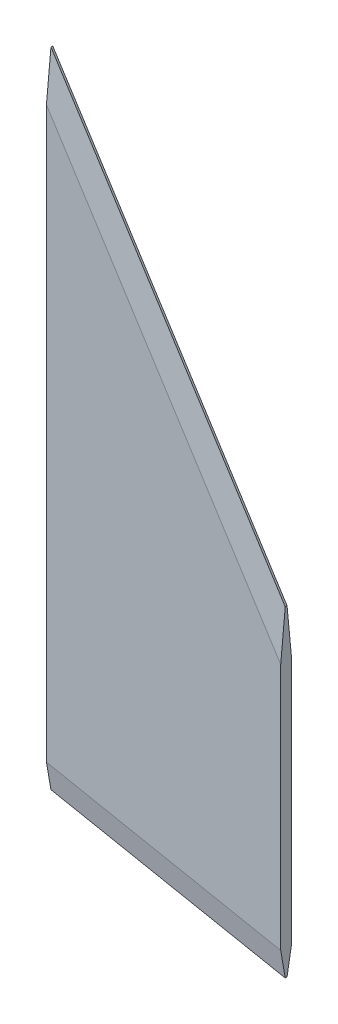
from build123d import *
from OCP.BRepFilletAPI import BRepFilletAPI_MakeChamfer

# Parameters (mm, degrees)
BOSS_EXTRUDE1_DEPTH = 1.5
CHAMFER1_SIZE       = 1.25
CHAMFER1_SIZE2      = 7.089102275


with BuildPart() as part:
    # Sketch1 → Boss-Extrude1 (new, symmetric)
    with BuildSketch(Plane.XY):
        Polygon((-60.98159975, 77.106512683), (-60.98159975, -100.693487317), (3.78840025, -113.393487317), (3.78840025, -24.493487317), align=None)
    extrude(amount=BOSS_EXTRUDE1_DEPTH, both=True)

    # Chamfer1: one chamfer whose edges measure the first distance from different faces: ONE call of the kernel's chamfer builder (chamfer() names one face for all edges)
    chamfer1_edges_1 = [part.edges().sort_by_distance(p)[0] for p in [
        (-28.59659975, -107.043487317, -1.5),
        (-28.59659975, -107.043487317, 1.5),
    ]]
    chamfer1_side_1 = [part.faces().sort_by_distance(p)[0] for p in [
        (-28.59659975, -107.043487317, 0),
    ]]
    chamfer1_edges_2 = [part.edges().sort_by_distance(p)[0] for p in [
        (-28.59659975, 26.306512683, -1.5),
        (-28.59659975, 26.306512683, 1.5),
    ]]
    chamfer1_side_2 = [part.faces().sort_by_distance(p)[0] for p in [
        (-28.59659975, 26.306512683, 0),
    ]]
    chamfer1 = BRepFilletAPI_MakeChamfer(part.part.solid().wrapped)
    for e in chamfer1_edges_1:
        chamfer1.Add(CHAMFER1_SIZE, CHAMFER1_SIZE2, e.wrapped, chamfer1_side_1[0].wrapped)  # the first distance lies on this face
    for e in chamfer1_edges_2:
        chamfer1.Add(CHAMFER1_SIZE, CHAMFER1_SIZE2, e.wrapped, chamfer1_side_2[0].wrapped)  # the first distance lies on this face
    add(Compound.cast(chamfer1.Shape()), mode=Mode.REPLACE)


solid = part.part
